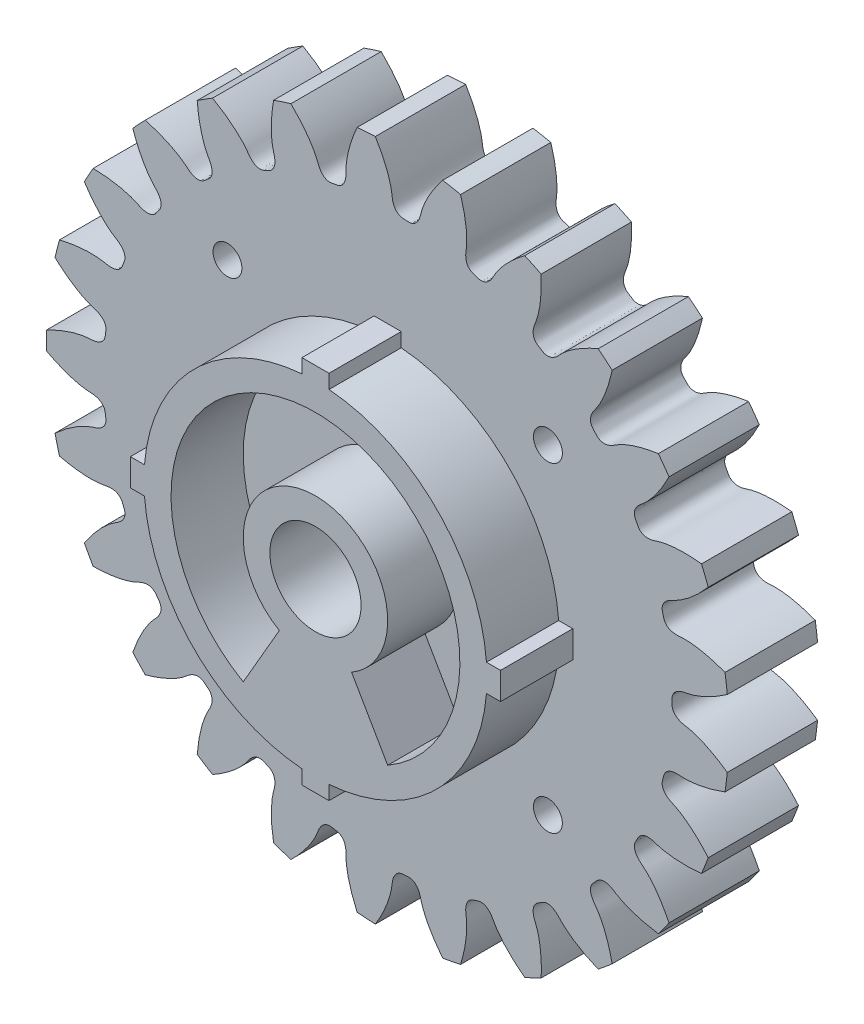
from build123d import *

# Parameters (mm, degrees)
SKETCHREVOLVESPURGEAR_W       = 10
SKETCHREVOLVESPURGEAR_H       = 37.8
TOOTHEXTRUDECUTSPURGEAR_DEPTH = 5
PATTERNSPURGEAR_COUNT         = 25
SKETCH5_R                     = 1.6
CUT_EXTRUDE2_DEPTH            = 10
SKETCH6_R                     = 19
BOSS_EXTRUDE1_DEPTH           = 8
CIRPATTERN3_COUNT             = 4
SKETCH8_W                     = 3
SKETCH8_H                     = 3
BOSS_EXTRUDE2_DEPTH           = 8
CIRPATTERN4_COUNT             = 4
SKETCH9_R                     = 5.05
CUT_EXTRUDE5_DEPTH            = 18
CUT_EXTRUDE6_DEPTH            = 6.5
CRVPATTERN1_START             = -5
CRVPATTERN1_OUTLINE_R         = 1.6
CRVPATTERN1_DEPTH             = 6.5


# Read off the part's stored shape, not the designer's step: CrvPattern1
with BuildPart() as part:
    # SketchRevolveSpurGear → SpurGear (revolve)
    with BuildSketch(Plane(origin=(0, 0, 0), x_dir=(0, 0, -1), z_dir=(1, 0, 0)), mode=Mode.PRIVATE) as spurgear_sk:
        with Locations((0, 18.9)):
            Rectangle(SKETCHREVOLVESPURGEAR_W, SKETCHREVOLVESPURGEAR_H)
    revolve(spurgear_sk.sketch.rotate(Axis((0, 0, 0), (0, 0, -1)), 90), axis=Axis((0, 0, 0), (0, 0, -1)))

    # SketchToothSpurGear → ToothExtrudeCutSpurGear (cut, symmetric)
    with BuildSketch(Plane.XY):
        with BuildLine():
            ThreePointArc((37.746215592, 3.829726949), (37.94, 0), (37.746215592, -3.829726949))
            add(Edge.make_bspline(
                [(37.746215592, -3.829726949), (37.466483699, -3.628766101), (37.04991397, -3.346329775), (36.493998691, -3.004317953), (36.105210331, -2.780261787), (35.734090233, -2.580361385), (35.381686129, -2.403405347), (35.048990413, -2.248142075), (34.73693868, -2.113282503), (34.446408505, -1.997502551), (34.178217902, -1.899444225), (33.933125155, -1.817721903), (33.711824587, -1.750911978), (33.514955545, -1.697595394), (33.34307073, -1.656236267), (33.038212839, -1.592324228), (32.736716629, -1.550959909), (32.449480325, -1.45659371), (32.311613232, -1.402037907), (32.17823805, -1.337513432), (32.04819332, -1.260532473), (31.920714964, -1.166868189), (31.79633739, -1.050531259), (31.678951839, -0.903953297), (31.577973414, -0.720573874), (31.515870655, -0.514514321), (31.490908676, -0.269488785), (31.505461765, 0), (31.490908676, 0.269488785), (31.515870655, 0.514514321), (31.577973414, 0.720573874), (31.678951839, 0.903953297), (31.79633739, 1.050531259), (31.920714964, 1.166868189), (32.04819332, 1.260532473), (32.17823805, 1.337513432), (32.311613232, 1.402037907), (32.449480325, 1.45659371), (32.736716629, 1.550959909), (33.038212839, 1.592324228), (33.34307073, 1.656236267), (33.514955545, 1.697595394), (33.711824587, 1.750911978), (33.933125155, 1.817721903), (34.178217902, 1.899444225), (34.446408505, 1.997502551), (34.73693868, 2.113282503), (35.048990413, 2.248142075), (35.381686129, 2.403405347), (35.734090233, 2.580361385), (36.105210331, 2.780261787), (36.493998691, 3.004317953), (37.04991397, 3.346329775), (37.466483699, 3.628766101), (37.746215592, 3.829726949)],
                knots=[0, 0, 0, 0, 0.066628363, 0.097312478, 0.126243214, 0.153420573, 0.178844554, 0.202515157, 0.224432382, 0.244596229, 0.263006698, 0.279663789, 0.294567502, 0.307717838, 0.319114795, 0.328758375, 0.367985616, 0.377666442, 0.387173495, 0.396651881, 0.406296908, 0.416367886, 0.427194119, 0.439149378, 0.452549791, 0.467442003, 0.480440239, 0.5, 0.519559761, 0.532557997, 0.547450209, 0.560850622, 0.572805881, 0.583632114, 0.593703092, 0.603348119, 0.612826505, 0.622333558, 0.632014384, 0.671241625, 0.680885205, 0.692282162, 0.705432498, 0.720336211, 0.736993302, 0.755403771, 0.775567618, 0.797484843, 0.821155446, 0.846579427, 0.873756786, 0.902687522, 0.933371637, 1, 1, 1, 1], degree=3))
        make_face()
    toothextrudecutspurgear = extrude(amount=TOOTHEXTRUDECUTSPURGEAR_DEPTH, both=True, mode=Mode.SUBTRACT)

    # PatternSpurGear: ToothExtrudeCutSpurGear ×25 about axis
    patternspurgear_axis = Axis((0, 0, 55), (0, 0, -1))
    for i in range(1, PATTERNSPURGEAR_COUNT):
        add(toothextrudecutspurgear.rotate(patternspurgear_axis, i * 360 / PATTERNSPURGEAR_COUNT), mode=Mode.SUBTRACT)

    # Sketch5 → Cut-Extrude2 (cut)
    with BuildSketch(Plane.XY.offset(5)):
        with Locations((17.748380208, 17.748380208)):
            Circle(SKETCH5_R)
    cut_extrude2 = extrude(amount=-CUT_EXTRUDE2_DEPTH, mode=Mode.SUBTRACT)

    # Sketch6 → Boss-Extrude1 (add)
    with BuildSketch(Plane.XY.offset(5)):
        with Locations(Location((0, 0, 0), (0, 0, 180))):
            Circle(SKETCH6_R)
        with BuildLine():
            Line((-4, -6.92820323), (-8, -13.856406461))
            ThreePointArc((-8, -13.856406461), (0, 16), (8, -13.856406461))
            Line((8, -13.856406461), (4, -6.92820323))
            ThreePointArc((4, -6.92820323), (0, 8), (-4, -6.92820323))
        make_face(mode=Mode.SUBTRACT)
    extrude(amount=BOSS_EXTRUDE1_DEPTH)

    # CirPattern3: Cut-Extrude2 ×4 about axis
    cirpattern3_axis = Axis((0, 0, 0), (0, 0, 1))
    for i in range(1, CIRPATTERN3_COUNT):
        add(cut_extrude2.rotate(cirpattern3_axis, i * 360 / CIRPATTERN3_COUNT), mode=Mode.SUBTRACT)

    # Sketch8 → Boss-Extrude2 (add)
    with BuildSketch(Plane.XY.offset(5)):
        with Locations((0, 19)):
            Rectangle(SKETCH8_W, SKETCH8_H)
    boss_extrude2 = extrude(amount=BOSS_EXTRUDE2_DEPTH)

    # CirPattern4: Boss-Extrude2 ×4 about axis
    cirpattern4_axis = Axis((0, 0, 0), (0, 0, 1))
    for i in range(1, CIRPATTERN4_COUNT):
        add(boss_extrude2.rotate(cirpattern4_axis, i * 360 / CIRPATTERN4_COUNT))

    # Sketch9 → Cut-Extrude5 (cut)
    with BuildSketch(Plane.XY.offset(13)):
        Circle(SKETCH9_R)
    extrude(amount=-CUT_EXTRUDE5_DEPTH, mode=Mode.SUBTRACT)

    # Sketch10 → Cut-Extrude6 (cut)
    with BuildSketch(Plane(origin=(0, 0, -5), x_dir=(-1, 0, 0), z_dir=(0, 0, -1))):
        Polygon((-17.748380208, 20.753380208), (-20.350786546, 19.250880208), (-20.350786546, 16.245880208), (-17.748380208, 14.743380208), (-15.145973869, 16.245880208), (-15.145973869, 19.250880208), align=None)
    extrude(amount=-CUT_EXTRUDE6_DEPTH, mode=Mode.SUBTRACT)

    # CrvPattern1 outline → CrvPattern1 (cut)
    # profile 1 of 3: a face of its own
    with BuildSketch(Plane.XY.offset(CRVPATTERN1_START)):
        Polygon((17.748380208, -14.743380208), (15.145973869, -16.245880208), (15.145973869, -19.250880208), (17.748380208, -20.753380208), (20.350786546, -19.250880208), (20.350786546, -16.245880208), align=None)
        with Locations((17.748380208, -17.748380208)):
            Circle(CRVPATTERN1_OUTLINE_R, mode=Mode.SUBTRACT)
    # profile 2 of 3: a face of its own
    with BuildSketch(Plane.XY.offset(CRVPATTERN1_START)):
        Polygon((-15.145973869, 19.250880208), (-17.748380208, 20.753380208), (-20.350786546, 19.250880208), (-20.350786546, 16.245880208), (-17.748380208, 14.743380208), (-15.145973869, 16.245880208), align=None)
        with Locations((-17.748380208, 17.748380208)):
            Circle(CRVPATTERN1_OUTLINE_R, mode=Mode.SUBTRACT)
    # profile 3 of 3: a face of its own
    with BuildSketch(Plane.XY.offset(CRVPATTERN1_START)):
        Polygon((-17.748380208, -14.743380208), (-20.350786546, -16.245880208), (-20.350786546, -19.250880208), (-17.748380208, -20.753380208), (-15.145973869, -19.250880208), (-15.145973869, -16.245880208), align=None)
        with Locations((-17.748380208, -17.748380208)):
            Circle(CRVPATTERN1_OUTLINE_R, mode=Mode.SUBTRACT)
    extrude(amount=CRVPATTERN1_DEPTH, mode=Mode.SUBTRACT)


solid = part.part
